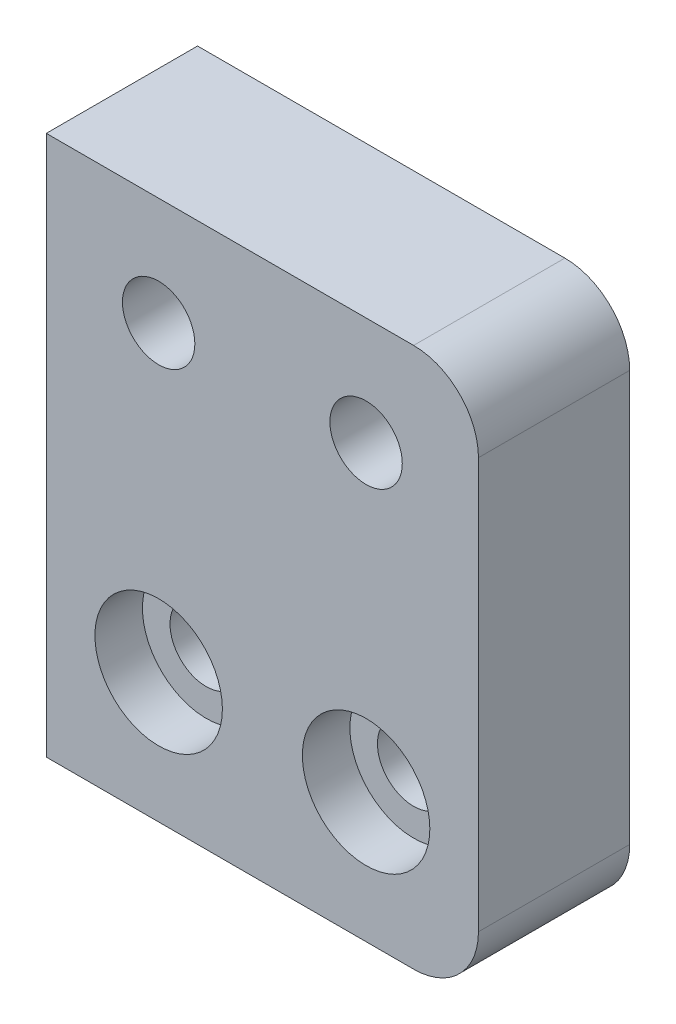
from build123d import *

# Parameters (mm, degrees)
SKETCH1_R           = 1.675
BOSS_EXTRUDE1_DEPTH = 7
SKETCH2_R           = 2.95
CUT_EXTRUDE1_DEPTH  = 2.2
SKETCH3_R           = 3
CUT_EXTRUDE2_DEPTH  = 2


with BuildPart() as part:
    # Sketch1 → Boss-Extrude1 (new body)
    with BuildSketch(Plane.XY):
        with BuildLine():
            Line((0, 0), (17, 0))
            ThreePointArc((17, 0), (19.121320344, 0.878679656), (20, 3))
            Line((20, 3), (20, 22))
            ThreePointArc((20, 22), (19.121320344, 24.121320344), (17, 25))
            Line((17, 25), (0, 25))
            Line((0, 25), (0, 0))
        make_face()
        with Locations((5.2, 20)):
            Circle(SKETCH1_R, mode=Mode.SUBTRACT)
        with Locations((14.8, 20)):
            Circle(SKETCH1_R, mode=Mode.SUBTRACT)
        with Locations((5.2, 6)):
            Circle(SKETCH1_R, mode=Mode.SUBTRACT)
        with Locations((14.8, 6)):
            Circle(SKETCH1_R, mode=Mode.SUBTRACT)
    extrude(amount=BOSS_EXTRUDE1_DEPTH)

    # Sketch2 → Cut-Extrude1 (cut)
    with BuildSketch(Plane.XY.offset(7)):
        with Locations((5.2, 6)):
            Circle(SKETCH2_R)
        with Locations((14.8, 6)):
            Circle(SKETCH2_R)
    extrude(amount=-CUT_EXTRUDE1_DEPTH, mode=Mode.SUBTRACT)

    # Sketch3 → Cut-Extrude2 (cut)
    with BuildSketch(Plane(origin=(0, 0, 0), x_dir=(-1, 0, 0), z_dir=(0, 0, -1))):
        with Locations((-14.8, 20)):
            Circle(SKETCH3_R)
        with Locations((-5.2, 20)):
            Circle(SKETCH3_R)
    extrude(amount=-CUT_EXTRUDE2_DEPTH, mode=Mode.SUBTRACT)


solid = part.part
